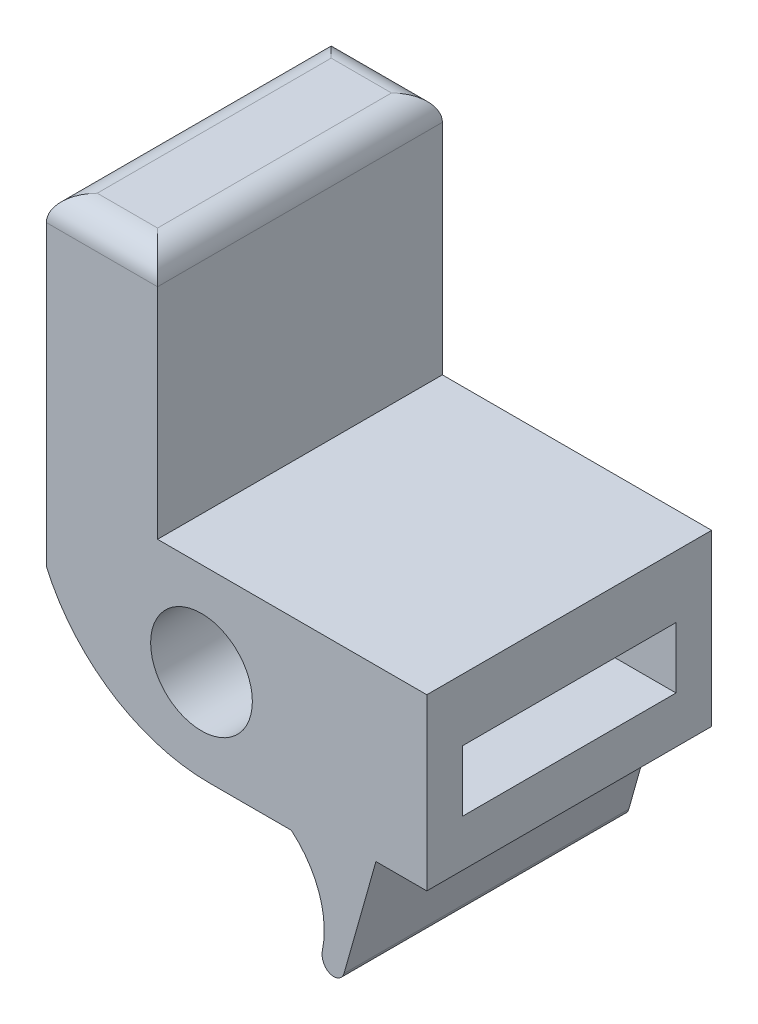
from build123d import *

# Parameters (mm, degrees)
CROQUIS1_W               = 5.98
CROQUIS1_H               = 2.26
CROQUIS1_R               = 1
SALIENTE_EXTRUIR1_DEPTH  = 3.2
CROQUIS2_W               = 2.18
CROQUIS2_H               = 0.38
SALIENTE_EXTRUIR2_DEPTH  = 3.2
CROQUIS4_W               = 1.68598805
CROQUIS4_H               = 3.2
SALIENTE_EXTRUIR3_DEPTH  = 5.5
SALIENTE_EXTRUIR4_DEPTH  = 3.2
REDONDEO2_R              = 0.3
REDONDEO3_R              = 0.21
CROQUIS6_W               = 3.2
CROQUIS6_H               = 7.76
SALIENTE_EXTRUIR5_DEPTH  = 0.5
CROQUIS7_W               = 2.18598805
CROQUIS7_H               = 7.76
SALIENTE_EXTRUIR6_DEPTH  = 1.6
SALIENTE_EXTRUIR7_START  = 1.6
SALIENTE_EXTRUIR7_DEPTH  = 1.6
CORTAR_EXTRUIR2_START    = -10
CORTAR_EXTRUIR2_DEPTH    = 10
CROQUIS11_W              = 4.8
CROQUIS11_H              = 2.64
SALIENTE_EXTRUIR8_DEPTH  = 1
CROQUIS15_W              = 4.3
CROQUIS15_H              = 4.8
SALIENTE_EXTRUIR10_DEPTH = 0.38
REDONDEO6_R              = 3.2
CROQUIS16_W              = 5.29401195
CROQUIS16_H              = 4.8
SALIENTE_EXTRUIR11_DEPTH = 0.4
SALIENTE_EXTRUIR12_START = 0.8
CROQUIS18_R              = 1
SALIENTE_EXTRUIR12_DEPTH = 0.8
REDONDEO7_R              = 0.5
CROQUIS19_W              = 4.2
CROQUIS19_H              = 1.2
CORTAR_EXTRUIR3_DEPTH    = 3
SALIENTE_EXTRUIR13_START = -5.6
CROQUIS20_W              = 5.29401195
CROQUIS20_H              = 0.3
SALIENTE_EXTRUIR13_DEPTH = 5.6


with BuildPart() as part:
    # Croquis1 → Saliente-Extruir1 (new body)
    with BuildSketch(Plane.XY):
        Rectangle(CROQUIS1_W, CROQUIS1_H)
        with Locations((-0.44, 0)):
            Circle(CROQUIS1_R, mode=Mode.SUBTRACT)
    extrude(amount=SALIENTE_EXTRUIR1_DEPTH)

    # Croquis2 → Saliente-Extruir2 (add)
    with BuildSketch(Plane.XY):
        with Locations((1.9, -1.32)):
            Rectangle(CROQUIS2_W, CROQUIS2_H)
    extrude(amount=SALIENTE_EXTRUIR2_DEPTH)

    # Croquis4 → Saliente-Extruir3 (add)
    with BuildSketch(Plane(origin=(0, 1.13, 0), x_dir=(1, 0, 0), z_dir=(0, 1, 0))):
        with Locations((-2.147005975, -1.6)):
            Rectangle(CROQUIS4_W, CROQUIS4_H)
    extrude(amount=SALIENTE_EXTRUIR3_DEPTH)

    # Croquis5 → Saliente-Extruir4 (add)
    with BuildSketch(Plane(origin=(0, 0, 0), x_dir=(-1, 0, 0), z_dir=(0, 0, -1))):
        with BuildLine():
            Line((-2.99, -1.51), (-2.312022185, -3.905922804))
            ThreePointArc((-2.312022185, -3.905922804), (-2.072768276, -3.925139809), (-1.86757295, -3.80061429))
            ThreePointArc((-1.86757295, -3.80061429), (-1.807264861, -2.439011425), (-0.81, -1.51))
            Line((-0.81, -1.51), (-2.99, -1.51))
        make_face()
    extrude(amount=-SALIENTE_EXTRUIR4_DEPTH)

    # Redondeo2
    # the kernel refuses this fillet: 0.3 mm, written as the material it takes off along each edge
    with BuildSketch(Plane(origin=(1.86757295, -3.80061429, -1.141887159), x_dir=(0.2702256968555762, 0.9627970049594662, 0), z_dir=(0, 0, 1))) as redondeo2_piece_1:
        with BuildLine():
            CenterArc((0.274279078, -0.299257177), REDONDEO2_R, 94.032824869, 117.548904109)
            Line((0.018710883, -0.456371459), (0.013599519, -0.459513744))
            ThreePointArc((0.013599519, -0.459513744), (-0.07043871, -0.231457229), (-0.005003521, 0.00331131))
            Line((-0.005003521, 0.00331131), (0.000421968, 0.005985144))
            ThreePointArc((0.000421968, 0.005985144), (0.126590344, 0.001543061), (0.25275872, 0.005985144))
            Line((0.25275872, 0.005985144), (0.253180688, 0))
        make_face()
    extrude(amount=5.483774318, mode=Mode.SUBTRACT)

    # Redondeo3
    redondeo3_edges = [part.edges().sort_by_distance(p)[0] for p in [
        (2.312022185, -3.905922804, 1.6),
    ]]
    fillet(redondeo3_edges, radius=REDONDEO3_R)

    # Croquis6 → Saliente-Extruir5 (add)
    with BuildSketch(Plane.ZY.offset(2.99)):
        with Locations((1.6, 2.75)):
            Rectangle(CROQUIS6_W, CROQUIS6_H)
    extrude(amount=SALIENTE_EXTRUIR5_DEPTH)

    # Croquis7 → Saliente-Extruir6 (add)
    with BuildSketch(Plane(origin=(0, 0, 0), x_dir=(-1, 0, 0), z_dir=(0, 0, -1))):
        with Locations((2.397005975, 2.75)):
            Rectangle(CROQUIS7_W, CROQUIS7_H)
    extrude(amount=SALIENTE_EXTRUIR6_DEPTH)

    # Croquis8 → Saliente-Extruir7 (add)
    with BuildSketch(Plane(origin=(0, 0, 0), x_dir=(-1, 0, 0), z_dir=(0, 0, -1)).offset(SALIENTE_EXTRUIR7_START)):
        with BuildLine():
            Line((-0.81, -1.13), (1.30401195, -1.13))
            Line((1.30401195, -1.13), (1.30401195, -0.503471301))
            ThreePointArc((1.30401195, -0.503471301), (-0.56, 0), (1.30401195, 0.503471301))
            Line((1.30401195, 0.503471301), (1.30401195, 1.13))
            Line((1.30401195, 1.13), (-2.99, 1.13))
            Line((-2.99, 1.13), (-2.99, -1.51))
            Line((-2.99, -1.51), (-2.361581826, -3.730782744))
            ThreePointArc((-2.361581826, -3.730782744), (-2.201095129, -3.879446502), (-1.995487215, -3.804731853))
            ThreePointArc((-1.995487215, -3.804731853), (-1.938099887, -3.687426244), (-1.935988878, -3.556852683))
            ThreePointArc((-1.935988878, -3.556852683), (-1.750154515, -2.325947779), (-0.81, -1.51))
            Line((-0.81, -1.51), (-0.81, -1.13))
        make_face()
    extrude(amount=-SALIENTE_EXTRUIR7_DEPTH)

    # Croquis9 → Cortar-Extruir2 (cut)
    with BuildSketch(Plane.XY.offset(CORTAR_EXTRUIR2_START)):
        with BuildLine():
            Line((-1.30401195, -0.503471301), (-1.30401195, 0.503471301))
            ThreePointArc((-1.30401195, 0.503471301), (-1.44, 0), (-1.30401195, -0.503471301))
        make_face()
    extrude(amount=CORTAR_EXTRUIR2_DEPTH, mode=Mode.SUBTRACT)

    # Croquis11 → Saliente-Extruir8 (add)
    with BuildSketch(Plane(origin=(2.99, 0, 0), x_dir=(0, 0, -1), z_dir=(1, 0, 0))):
        with Locations((-0.8, -0.19)):
            Rectangle(CROQUIS11_W, CROQUIS11_H)
    extrude(amount=SALIENTE_EXTRUIR8_DEPTH)

    # Croquis15 → Saliente-Extruir10 (add)
    with BuildSketch(Plane.XZ.offset(1.13)):
        with Locations((-1.34, 0.8)):
            Rectangle(CROQUIS15_W, CROQUIS15_H)
    extrude(amount=SALIENTE_EXTRUIR10_DEPTH)

    # Redondeo6
    redondeo6_edges = [part.edges().sort_by_distance(p)[0] for p in [
        (-3.49, -1.51, 0.8),
    ]]
    fillet(redondeo6_edges, radius=REDONDEO6_R)

    # Croquis16 → Saliente-Extruir11 (add)
    with BuildSketch(Plane(origin=(0, 1.13, 0), x_dir=(1, 0, 0), z_dir=(0, 1, 0))):
        with Locations((1.342994025, -0.8)):
            Rectangle(CROQUIS16_W, CROQUIS16_H)
    extrude(amount=SALIENTE_EXTRUIR11_DEPTH)

    # Croquis18 → Saliente-Extruir12 (add)
    with BuildSketch(Plane(origin=(0, 0, -1.6), x_dir=(-1, 0, 0), z_dir=(0, 0, -1)).offset(SALIENTE_EXTRUIR12_START)):
        with BuildLine():
            Line((-0.81, -1.51), (0.29, -1.51))
            ThreePointArc((0.29, -1.51), (2.5527417, -0.5727417), (3.49, 1.69))
            Line((3.49, 1.69), (3.49, 6.63))
            Line((3.49, 6.63), (1.30401195, 6.63))
            Line((1.30401195, 6.63), (1.30401195, 1.53))
            Line((1.30401195, 1.53), (-3.99, 1.53))
            Line((-3.99, 1.53), (-3.99, -1.51))
            Line((-3.99, -1.51), (-2.99, -1.51))
            Line((-2.99, -1.51), (-2.361581826, -3.730782744))
            ThreePointArc((-2.361581826, -3.730782744), (-2.201095129, -3.879446502), (-1.995487215, -3.804731853))
            ThreePointArc((-1.995487215, -3.804731853), (-1.938099887, -3.687426244), (-1.935988878, -3.556852683))
            ThreePointArc((-1.935988878, -3.556852683), (-1.750154515, -2.325947779), (-0.81, -1.51))
        make_face()
        with Locations((0.44, 0)):
            Circle(CROQUIS18_R, mode=Mode.SUBTRACT)
    extrude(amount=-SALIENTE_EXTRUIR12_DEPTH)

    # Redondeo7
    redondeo7_edges = [part.edges().sort_by_distance(p)[0] for p in [
        (-2.397005975, 6.63, -2.4),
        (-2.397005975, 6.63, 3.2),
        (-1.30401195, 6.63, 0.4),
        (-3.49, 6.63, 0.4),
    ]]
    fillet(redondeo7_edges, radius=REDONDEO7_R)

    # Croquis19 → Cortar-Extruir3 (cut)
    with BuildSketch(Plane(origin=(3.99, 0, 0), x_dir=(0, 0, -1), z_dir=(1, 0, 0))):
        with Locations((-0.4, 0.01)):
            Rectangle(CROQUIS19_W, CROQUIS19_H)
    extrude(amount=-CORTAR_EXTRUIR3_DEPTH, mode=Mode.SUBTRACT)

    # Croquis20 → Saliente-Extruir13 (add)
    with BuildSketch(Plane.XY.offset(3.2).offset(SALIENTE_EXTRUIR13_START)):
        with Locations((1.342994025, 1.68)):
            Rectangle(CROQUIS20_W, CROQUIS20_H)
        with BuildLine():
            Line((-3.49, 1.69), (-3.49, 0.272255312))
            ThreePointArc((-3.49, 0.272255312), (-2.198912464, -1.243607541), (-0.29, -1.81))
            Line((-0.29, -1.81), (1.324488812, -1.81))
            ThreePointArc((1.324488812, -1.81), (1.079738106, -1.63857377), (0.81, -1.51))
            Line((0.81, -1.51), (-0.29, -1.51))
            ThreePointArc((-0.29, -1.51), (-2.5527417, -0.5727417), (-3.49, 1.69))
        make_face()
    extrude(amount=SALIENTE_EXTRUIR13_DEPTH)


solid = part.part
